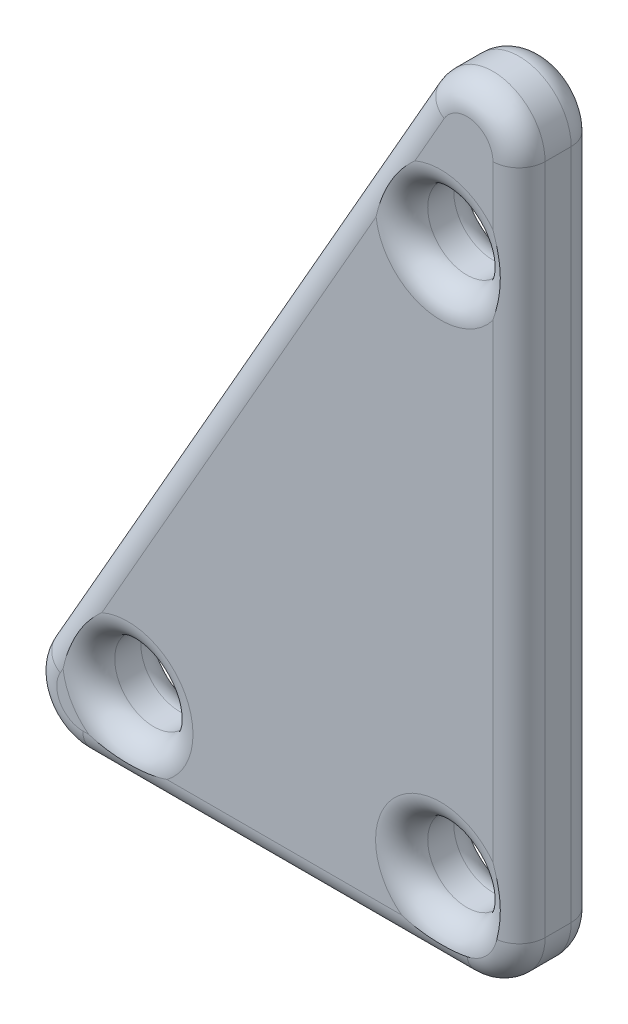
from build123d import *

# Parameters (mm, degrees)
SKETCH1_R           = 1.5
BOSS_EXTRUDE1_DEPTH = 3
FILLET1_R           = 1


with BuildPart() as part:
    # Sketch1 → Boss-Extrude1 (new body)
    with BuildSketch(Plane.XY):
        with BuildLine():
            Line((3, 24.765564437), (3, -1))
            ThreePointArc((3, -1), (2.414213562, -2.414213562), (1, -3))
            Line((1, -3), (-12, -3))
            Line((-12, -3), (-13.723179678, -3))
            ThreePointArc((-13.723179678, -3), (-15.452999865, -2.003853636), (-15.459665963, -0.007722123))
            Line((-15.459665963, -0.007722123), (-0.736486284, 25.757842314))
            ThreePointArc((-0.736486284, 25.757842314), (1.51333587, 26.698563735), (3, 24.765564437))
        make_face()
        Circle(SKETCH1_R, mode=Mode.SUBTRACT)
        with Locations((0, 21)):
            Circle(SKETCH1_R, mode=Mode.SUBTRACT)
        with Locations((-12, 0)):
            Circle(SKETCH1_R, mode=Mode.SUBTRACT)
    extrude(amount=BOSS_EXTRUDE1_DEPTH)

    # Fillet1
    # the kernel refuses this fillet: 1 mm, written as the material it takes off along each edge
    with BuildSketch(Plane(origin=(-13.723179678, -1, 0), x_dir=(0, -1, 0), z_dir=(1, 0, 0))) as fillet1_piece_1:
        with BuildLine():
            CenterArc((2 - FILLET1_R, -FILLET1_R), FILLET1_R, 0, 90)
            Line((2 - FILLET1_R, 0), (2, 0))
            Line((2, 0), (2, -FILLET1_R))
        make_face()
    revolve(axis=Axis((-13.723179678, -1, 0), (0, 0, -1)), revolution_arc=119.744881297, mode=Mode.SUBTRACT)
    with BuildSketch(Plane(origin=(1, -1, 3), x_dir=(1, 0, 0), z_dir=(0, 1, 0))) as fillet1_piece_2:
        with BuildLine():
            CenterArc((2 - FILLET1_R, FILLET1_R), FILLET1_R, 270, 90)
            Line((2, FILLET1_R), (2, 0))
            Line((2, 0), (2 - FILLET1_R, 0))
        make_face()
    revolve(axis=Axis((1, -1, 3), (0, 0, -1)), revolution_arc=90, mode=Mode.SUBTRACT)
    with BuildSketch(Plane(origin=(0, 21, 0), x_dir=(1, 0, 0), z_dir=(0, -1, 0))) as fillet1_piece_3:
        with BuildLine():
            CenterArc((1.5 + FILLET1_R, FILLET1_R), FILLET1_R, 180, 90)
            Line((1.5 + FILLET1_R, 0), (1.5, 0))
            Line((1.5, 0), (1.5, FILLET1_R))
        make_face()
    revolve(axis=Axis((0, 21, 0), (0, 0, 1)), mode=Mode.SUBTRACT)
    with BuildSketch(Plane(origin=(0, 21, 3), x_dir=(1, 0, 0), z_dir=(0, -1, 0))) as fillet1_piece_4:
        with BuildLine():
            CenterArc((1.5 + FILLET1_R, -FILLET1_R), FILLET1_R, 90, 90)
            Line((1.5, -FILLET1_R), (1.5, 0))
            Line((1.5, 0), (1.5 + FILLET1_R, 0))
        make_face()
    revolve(axis=Axis((0, 21, 3), (0, 0, 1)), mode=Mode.SUBTRACT)
    with BuildSketch(Plane(origin=(3, 24.765564437, 3), x_dir=(0, 0, -1), z_dir=(0, -1, 0))) as fillet1_piece_5:
        with BuildLine():
            CenterArc((FILLET1_R, -FILLET1_R), FILLET1_R, 90, 90)
            Line((0, -FILLET1_R), (0, 0))
            Line((0, 0), (FILLET1_R, 0))
        make_face()
    extrude(amount=25.765564437, mode=Mode.SUBTRACT)
    with BuildSketch(Plane(origin=(0, 0, 0), x_dir=(1, 0, 0), z_dir=(0, -1, 0))) as fillet1_piece_6:
        with BuildLine():
            CenterArc((1.5 + FILLET1_R, FILLET1_R), FILLET1_R, 180, 90)
            Line((1.5 + FILLET1_R, 0), (1.5, 0))
            Line((1.5, 0), (1.5, FILLET1_R))
        make_face()
    revolve(axis=Axis((0, 0, 0), (0, 0, 1)), mode=Mode.SUBTRACT)
    with BuildSketch(Plane(origin=(0, 0, 3), x_dir=(1, 0, 0), z_dir=(0, -1, 0))) as fillet1_piece_7:
        with BuildLine():
            CenterArc((1.5 + FILLET1_R, -FILLET1_R), FILLET1_R, 90, 90)
            Line((1.5, -FILLET1_R), (1.5, 0))
            Line((1.5, 0), (1.5 + FILLET1_R, 0))
        make_face()
    revolve(axis=Axis((0, 0, 3), (0, 0, 1)), mode=Mode.SUBTRACT)
    with BuildSketch(Plane(origin=(1, 24.765564437, 3), x_dir=(-0.8682431421244858, 0.49613893835678746, 0), z_dir=(-0.49613893835678746, -0.8682431421244858, 0))) as fillet1_piece_8:
        with BuildLine():
            CenterArc((2 - FILLET1_R, FILLET1_R), FILLET1_R, 270, 90)
            Line((2, FILLET1_R), (2, 0))
            Line((2, 0), (2 - FILLET1_R, 0))
        make_face()
    revolve(axis=Axis((1, 24.765564437, 3), (0, 0, -1)), revolution_arc=150.255118703, mode=Mode.SUBTRACT)
    with BuildSketch(Plane(origin=(-12, 0, 0), x_dir=(1, 0, 0), z_dir=(0, -1, 0))) as fillet1_piece_9:
        with BuildLine():
            CenterArc((1.5 + FILLET1_R, FILLET1_R), FILLET1_R, 180, 90)
            Line((1.5 + FILLET1_R, 0), (1.5, 0))
            Line((1.5, 0), (1.5, FILLET1_R))
        make_face()
    revolve(axis=Axis((-12, 0, 0), (0, 0, 1)), mode=Mode.SUBTRACT)
    with BuildSketch(Plane(origin=(-12, 0, 3), x_dir=(1, 0, 0), z_dir=(0, -1, 0))) as fillet1_piece_10:
        with BuildLine():
            CenterArc((1.5 + FILLET1_R, -FILLET1_R), FILLET1_R, 90, 90)
            Line((1.5, -FILLET1_R), (1.5, 0))
            Line((1.5, 0), (1.5 + FILLET1_R, 0))
        make_face()
    revolve(axis=Axis((-12, 0, 3), (0, 0, 1)), mode=Mode.SUBTRACT)
    with BuildSketch(Plane(origin=(-15.459665963, -0.007722123, 3), x_dir=(0.8682431421244593, -0.4961389383568337, 0), z_dir=(0.49613893835683376, 0.8682431421244593, 0)), Plane(origin=(-15.459665963, -0.007722123, 0), x_dir=(0, 0, 1), z_dir=(0.49613893835683376, 0.8682431421244593, 0))) as fillet1_piece_11:
        with BuildLine():
            CenterArc((FILLET1_R, FILLET1_R), FILLET1_R, 180, 90)
            Line((0, FILLET1_R), (0, 0))
            Line((0, 0), (FILLET1_R, 0))
        make_face()
    extrude(amount=29.67551736, mode=Mode.SUBTRACT)
    with BuildSketch(Plane(origin=(-13.723179678, -1, 3), x_dir=(0, -1, 0), z_dir=(1, 0, 0))) as fillet1_piece_12:
        with BuildLine():
            CenterArc((2 - FILLET1_R, FILLET1_R), FILLET1_R, 270, 90)
            Line((2, FILLET1_R), (2, 0))
            Line((2, 0), (2 - FILLET1_R, 0))
        make_face()
    revolve(axis=Axis((-13.723179678, -1, 3), (0, 0, -1)), revolution_arc=119.744881297, mode=Mode.SUBTRACT)
    with BuildSketch(Plane(origin=(1, 24.765564437, 0), x_dir=(-0.8682431421244858, 0.49613893835678746, 0), z_dir=(-0.49613893835678746, -0.8682431421244858, 0))) as fillet1_piece_13:
        with BuildLine():
            CenterArc((2 - FILLET1_R, -FILLET1_R), FILLET1_R, 0, 90)
            Line((2, -FILLET1_R), (2, 0))
            Line((2, 0), (2 - FILLET1_R, 0))
        make_face()
    revolve(axis=Axis((1, 24.765564437, 0), (0, 0, -1)), revolution_arc=150.255118703, mode=Mode.SUBTRACT)
    with BuildSketch(Plane(origin=(3, 24.765564437, 0), x_dir=(0, 0, 1), z_dir=(0, -1, 0))) as fillet1_piece_14:
        with BuildLine():
            CenterArc((FILLET1_R, FILLET1_R), FILLET1_R, 180, 90)
            Line((0, FILLET1_R), (0, 0))
            Line((0, 0), (FILLET1_R, 0))
        make_face()
    extrude(amount=25.765564437, mode=Mode.SUBTRACT)
    with BuildSketch(Plane(origin=(1, -1, 0), x_dir=(1, 0, 0), z_dir=(0, 1, 0))) as fillet1_piece_15:
        with BuildLine():
            CenterArc((2 - FILLET1_R, -FILLET1_R), FILLET1_R, 0, 90)
            Line((2, -FILLET1_R), (2, 0))
            Line((2, 0), (2 - FILLET1_R, 0))
        make_face()
    revolve(axis=Axis((1, -1, 0), (0, 0, -1)), revolution_arc=90, mode=Mode.SUBTRACT)
    with BuildSketch(Plane(origin=(1, -3, 3), x_dir=(0, 1, 0), z_dir=(-1, 0, 0))) as fillet1_piece_16:
        with BuildLine():
            CenterArc((FILLET1_R, FILLET1_R), FILLET1_R, 180, 90)
            Line((0, FILLET1_R), (0, 0))
            Line((0, 0), (FILLET1_R, 0))
        make_face()
    extrude(amount=14.723179678, mode=Mode.SUBTRACT)
    with BuildSketch(Plane(origin=(-13.723179678, -3, 0), x_dir=(0, 0, 1), z_dir=(1, 0, 0))) as fillet1_piece_17:
        with BuildLine():
            CenterArc((FILLET1_R, -FILLET1_R), FILLET1_R, 90, 90)
            Line((0, -FILLET1_R), (0, 0))
            Line((0, 0), (FILLET1_R, 0))
        make_face()
    extrude(amount=14.723179678, mode=Mode.SUBTRACT)


solid = part.part
